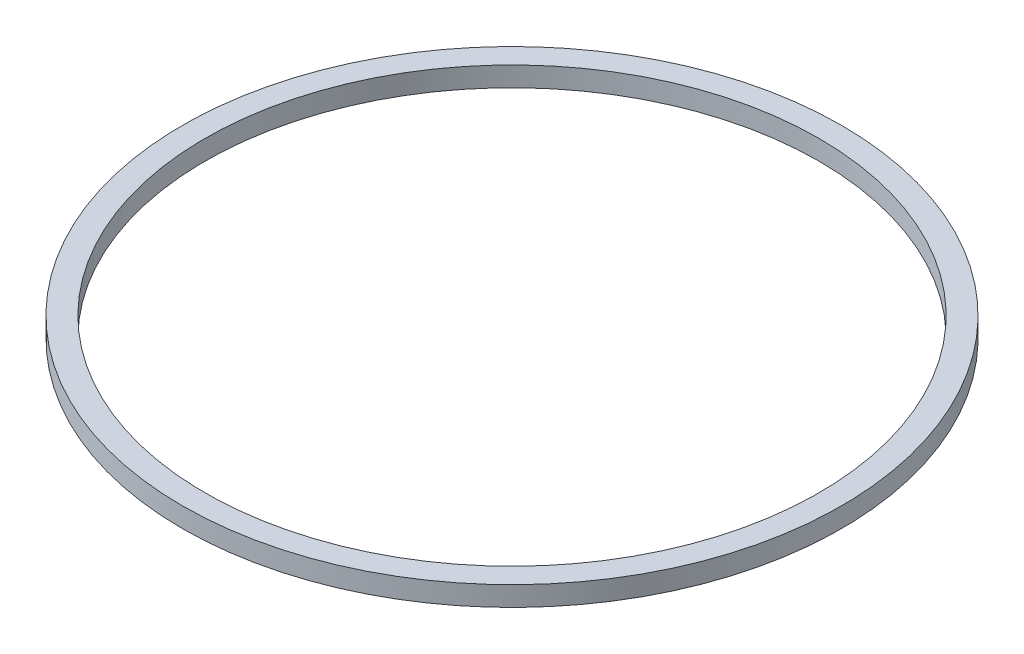
from build123d import *

# Parameters (mm, degrees)
SKETCH1_W = 7.5
SKETCH1_H = 6.56


with BuildPart() as part:
    # Sketch1 → Revolve1 (revolve)
    with BuildSketch(Plane.XY):
        with Locations((-105.75, 6.455)):
            Rectangle(SKETCH1_W, SKETCH1_H)
    revolve(axis=Axis((0, -200069.047495165, 0), (0, 1, 0)))


solid = part.part
